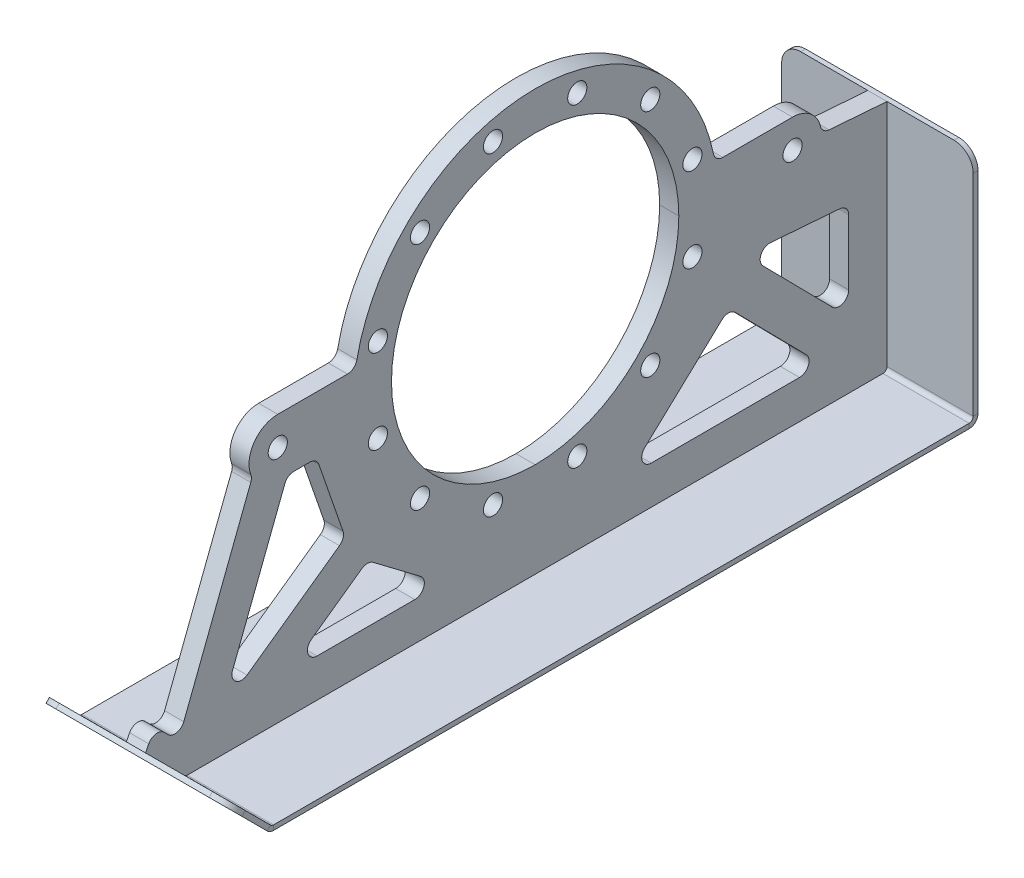
from build123d import *

# Parameters (mm, degrees)
FLANGE_PROFILE_DEPTH                = 12.7
F_7_8_1_DIAMETER_HOLE1_D            = 25.4
BOLT_PATTERN_COUNT                  = 12
SKETCH15_R                          = 12.7
BOSS_EXTRUDE1_DEPTH                 = 12.7
SKETCH5_W                           = 254
SKETCH5_H                           = 1317.865260112
BASE_SKID_DEPTH                     = 6.35
BEND_START                          = -127
BEND_HEEL_DEPTH                     = 254
BEND_HEEL_2_DEPTH                   = 254
BEND_TOE_DEPTH                      = 254
BEND_TOE_2_DEPTH                    = 254
WEBBING_BODY_DEPTH                  = 12.7
WEBBING_HOLES_DEPTH                 = 774.747599071
WEBBING_HOLES_DEPTH_BACK            = 774.747599071
WEBBING_FILLET_R                    = 12.7
SKID_START                          = -472.929130056
SKID_EDGES_DEPTH                    = 6.35
SKID_START_2                        = -334.061851681
SKID_EDGES_2_DEPTH                  = 6.35
FLANGE_FILLET_R                     = 12.7
FILLET1_R                           = 12.7
CONVERT_START                       = -12.7
CONVERT_FLANGE_TO_SHEET_OUTLINE_R   = 12.7
CONVERT_FLANGE_TO_SHEET_OUTLINE_R_2 = 190.5
CONVERT_FLANGE_TO_SHEET_DEPTH       = 25.4


# Read off the part's stored shape, not the designer's step: Bend Heel, Bend Toe, Skid Edges, Convert Flange to Sheet
# Sheet-metal steps are written as plain solids
with BuildPart() as part:
    # Sketch1 → Flange Profile (new, symmetric)
    with BuildSketch(Plane(origin=(0, 0, 0), x_dir=(0, 0, -1), z_dir=(1, 0, 0))):
        with BuildLine():
            ThreePointArc((-190.5, 316.3), (0, 506.8), (190.5, 316.3))
            Line((190.5, 316.3), (241.3, 316.3))
            ThreePointArc((241.3, 316.3), (0, 557.6), (-241.3, 316.3))
            Line((-241.3, 316.3), (-190.5, 316.3))
        make_face()
        with BuildLine():
            Line((241.3, 316.3), (190.5, 316.3))
            ThreePointArc((190.5, 316.3), (0, 125.8), (-190.5, 316.3))
            Line((-190.5, 316.3), (-241.3, 316.3))
            ThreePointArc((-241.3, 316.3), (0, 75), (241.3, 316.3))
        make_face()
    extrude(amount=FLANGE_PROFILE_DEPTH, both=True)

    # 7/8 (1) Diameter Hole1 (through all)
    with Locations(Plane(origin=(12.7, 260.420968162, -208.543385896), x_dir=(0, 0, 1), z_dir=(1, 0, 0))):
        with Locations((0, 0)):
            f_7_8_1_diameter_hole1 = Hole(F_7_8_1_DIAMETER_HOLE1_D / 2)

    # Bolt Pattern: 7/8 (1) Diameter Hole1 ×12 about axis
    bolt_pattern_axis = Axis((0, 316.3, 0), (1, 0, 0))
    for i in range(1, BOLT_PATTERN_COUNT):
        add(f_7_8_1_diameter_hole1.rotate(bolt_pattern_axis, i * 360 / BOLT_PATTERN_COUNT), mode=Mode.SUBTRACT)

    # Sketch15 → Boss-Extrude1 (add, symmetric)
    with BuildSketch(Plane(origin=(0, 0, 0), x_dir=(0, 0, -1), z_dir=(1, 0, 0))):
        with BuildLine():
            Line((-238.273120599, 278.2), (-341.3, 278.2))
            ThreePointArc((-341.3, 278.2), (-379.4, 316.3), (-341.3, 354.4))
            Line((-341.3, 354.4), (-238.273120599, 354.4))
            ThreePointArc((-238.273120599, 354.4), (-200.173120599, 316.3), (-238.273120599, 278.2))
        make_face()
        with Locations((-341.3, 316.3)):
            Circle(SKETCH15_R, mode=Mode.SUBTRACT)
    boss_extrude1 = extrude(amount=BOSS_EXTRUDE1_DEPTH, both=True)

    # Mirror2: Boss-Extrude1 across plane
    add(boss_extrude1.mirror(Plane.XY))

    # Sketch12 → Webbing Body (add, symmetric)
    with BuildSketch(Plane(origin=(0, 0, 0), x_dir=(0, 0, -1), z_dir=(1, 0, 0))):
        with BuildLine():
            Line((-516.69946035, 53.244915153), (-465.016837626, 1.562292429))
            ThreePointArc((-465.016837626, 1.562292429), (-463.286363484, 0.406026574), (-461.245130056, 0))
            Line((-461.245130056, 0), (461.245130056, 0))
            ThreePointArc((461.245130056, 0), (465.016837626, 1.562292429), (466.579130056, 5.334))
            Line((466.579130056, 5.334), (466.579130056, 309.66453199))
            Line((466.579130056, 309.66453199), (379.4, 316.3))
            ThreePointArc((379.4, 316.3), (368.240768363, 289.359231637), (341.3, 278.2))
            Line((341.3, 278.2), (238.273120599, 278.2))
            ThreePointArc((238.273120599, 278.2), (0, 75), (-238.273120599, 278.2))
            Line((-238.273120599, 278.2), (-341.3, 278.2))
            ThreePointArc((-341.3, 278.2), (-368.240768363, 289.359231637), (-379.4, 316.3))
            Line((-379.4, 316.3), (-516.69946035, 53.244915153))
        make_face()
    extrude(amount=WEBBING_BODY_DEPTH, both=True)

    # Sketch13 → Webbing Holes (cut, two sides: drawn at the far end of the back side and taken through both)
    with BuildSketch(Plane(origin=(0, 0, 0), x_dir=(0, 0, -1), z_dir=(1, 0, 0)).offset(-WEBBING_HOLES_DEPTH_BACK)):
        Polygon((-121.787355666, 50.8), (-328.927773528, 50.8), (-222.270083081, 126.778444056), align=None)
        Polygon((256.684840666, 176.88944598), (380.833369116, 50.8), (121.787355666, 50.8), align=None)
        Polygon((415.779130056, 216.93171249), (415.779130056, 87.713713005), (278.243059213, 227.4), align=None)
        Polygon((-416.484090731, 50.8), (-251.744141406, 168.15379766), (-289.7865603, 278.2), (-328.771856678, 278.2), align=None)
        with BuildLine():
            Line((-504.380536196, 76.847015483), (-379.4, 316.3))
            ThreePointArc((-379.4, 316.3), (-378.339738675, 307.374320256), (-375.217965412, 298.945414949))
            Line((-375.217965412, 298.945414949), (-472.992285501, 45.458764788))
            Line((-472.992285501, 45.458764788), (-504.380536196, 76.847015483))
        make_face()
    extrude(amount=WEBBING_HOLES_DEPTH + WEBBING_HOLES_DEPTH_BACK, mode=Mode.SUBTRACT)

    # Webbing Fillet
    webbing_fillet_edges = [part.edges().sort_by_distance(p)[0] for p in [
        (0, 50.8, 416.484090731),
        (0, 278.2, 328.771856678),
        (0, 278.2, 289.7865603),
        (0, 168.15379766, 251.744141406),
        (0, 176.88944598, -256.684840666),
        (0, 50.8, -380.833369116),
        (0, 50.8, -121.787355666),
        (0, 216.93171249, -415.779130056),
        (0, 87.713713005, -415.779130056),
        (0, 227.4, -278.243059213),
        (0, 50.8, 121.787355666),
        (0, 50.8, 328.927773528),
        (0, 126.778444056, 222.270083081),
    ]]
    fillet(webbing_fillet_edges, radius=WEBBING_FILLET_R)

    # Flange Fillet
    flange_fillet_edges = [part.edges().sort_by_distance(p)[0] for p in [
        (0, 298.945414949, 375.217965412),
        (0, 354.4, 238.273120599),
        (0, 354.4, -238.273120599),
        (0, 316.3, -379.4),
    ]]
    fillet(flange_fillet_edges, radius=FLANGE_FILLET_R)

    # Fillet1
    fillet1_edges = [part.edges().sort_by_distance(p)[0] for p in [
        (0, 76.847015483, 504.380536196),
        (0, 45.458764788, 472.992285501),
    ]]
    fillet(fillet1_edges, radius=FILLET1_R)


with BuildPart() as body_2:
    # Sketch5 → Base Skid (new body)
    with BuildSketch(Plane(origin=(0, 0, 0), x_dir=(1, 0, 0), z_dir=(0, 1, 0))):
        with Locations((0, 118.6125)):
            Rectangle(SKETCH5_W, SKETCH5_H)
    extrude(amount=-BASE_SKID_DEPTH)

    # Bend Heel outline → Bend Heel (cut)
    with BuildSketch(Plane.YZ.offset(BEND_START)):
        with BuildLine():
            Line((0, -777.545130056), (0, -471.640528076))
            ThreePointArc((0, -471.640528076), (-4.636915504, -467.33583609), (-6.35, -461.245130056))
            Line((-6.35, -461.245130056), (-6.35, -777.545130056))
            Line((-6.35, -777.545130056), (0, -777.545130056))
        make_face()
    extrude(amount=BEND_HEEL_DEPTH, mode=Mode.SUBTRACT)

    # Bend Heel 2 outline → Bend Heel 2 (add)
    with BuildSketch(Plane.YZ.offset(BEND_START)):
        with BuildLine():
            Line((5.334, -472.929130056), (309.66453199, -472.929130056))
            Line((309.66453199, -472.929130056), (309.66453199, -466.579130056))
            Line((309.66453199, -466.579130056), (5.334, -466.579130056))
            ThreePointArc((5.334, -466.579130056), (1.56229243, -465.016837626), (0, -461.245130056))
            Line((0, -461.245130056), (0, -471.640528076))
            ThreePointArc((0, -471.640528076), (2.590277571, -472.602411563), (5.334, -472.929130056))
        make_face()
    extrude(amount=BEND_HEEL_2_DEPTH)

    # Bend Toe outline → Bend Toe (cut)
    with BuildSketch(Plane.YZ.offset(BEND_START)):
        with BuildLine():
            Line((-6.35, 540.320130056), (-6.35, 461.245130056))
            ThreePointArc((-6.35, 461.245130056), (-5.460608458, 465.71640328), (-2.927835631, 469.506965687))
            Line((-2.927835631, 469.506965687), (0, 472.434801318))
            Line((0, 472.434801318), (0, 540.320130056))
            Line((0, 540.320130056), (-6.35, 540.320130056))
        make_face()
    extrude(amount=BEND_TOE_DEPTH, mode=Mode.SUBTRACT)

    # Bend Toe 2 outline → Bend Toe 2 (add)
    with BuildSketch(Plane.YZ.offset(BEND_START)):
        with BuildLine():
            Line((48.754787092, 521.189588411), (0, 472.434801318))
            Line((0, 472.434801318), (0, 461.245130056))
            ThreePointArc((0, 461.245130056), (0.406026574, 463.286363484), (1.562292429, 465.016837626))
            Line((1.562292429, 465.016837626), (53.244915153, 516.69946035))
            Line((53.244915153, 516.69946035), (48.754787092, 521.189588411))
        make_face()
    extrude(amount=BEND_TOE_2_DEPTH)

    # Skid Edges outline → Skid Edges (cut)
    with BuildSketch(Plane.XY.offset(SKID_START)):
        with BuildLine():
            ThreePointArc((-127, 284.26453199), (-119.560512242, 302.225044232), (-101.6, 309.66453199))
            Line((-101.6, 309.66453199), (-127, 309.66453199))
            Line((-127, 309.66453199), (-127, 284.26453199))
        make_face()
        with BuildLine():
            ThreePointArc((101.6, 309.66453199), (119.560512242, 302.225044232), (127, 284.26453199))
            Line((127, 284.26453199), (127, 309.66453199))
            Line((127, 309.66453199), (101.6, 309.66453199))
        make_face()
    extrude(amount=SKID_EDGES_DEPTH, mode=Mode.SUBTRACT)

    # Skid Edges 2 outline → Skid Edges 2 (cut)
    with BuildSketch(Plane(origin=(0, 0, 0), x_dir=(1, 0, 0), z_dir=(0, 0.707106781186546, -0.707106781186549)).offset(SKID_START_2)):
        with BuildLine():
            Line((-127, -403.011532817), (-101.6, -403.011532817))
            ThreePointArc((-101.6, -403.011532817), (-119.560512242, -395.572045059), (-127, -377.611532817))
            Line((-127, -377.611532817), (-127, -403.011532817))
        make_face()
        with BuildLine():
            ThreePointArc((127, -377.611532817), (119.560512242, -395.572045059), (101.6, -403.011532817))
            Line((101.6, -403.011532817), (127, -403.011532817))
            Line((127, -403.011532817), (127, -377.611532817))
        make_face()
    extrude(amount=SKID_EDGES_2_DEPTH, mode=Mode.SUBTRACT)


with BuildPart() as body_3:
    # Convert Flange to Sheet outline → Convert Flange to Sheet (new body)
    with BuildSketch(Plane.YZ.offset(CONVERT_START)):
        with BuildLine():
            ThreePointArc((64.613364326, 492.146885039), (68.186341854, 503.052322953), (61.509490514, 512.385832512))
            Line((61.509490514, 512.385832512), (53.244915153, 516.69946035))
            Line((53.244915153, 516.69946035), (1.562292429, 465.016837626))
            ThreePointArc((1.562292429, 465.016837626), (0.406026574, 463.286363484), (0, 461.245130056))
            Line((0, 461.245130056), (0, -461.245130056))
            ThreePointArc((0, -461.245130056), (1.56229243, -465.016837626), (5.334, -466.579130056))
            Line((5.334, -466.579130056), (309.66453199, -466.579130056))
            Line((309.66453199, -466.579130056), (315.51389229, -389.728161662))
            ThreePointArc((315.51389229, -389.728161662), (318.507984292, -382.458236277), (325.207948432, -378.344007002))
            ThreePointArc((325.207948432, -378.344007002), (346.224929701, -364.881954592), (354.4, -341.3))
            Line((354.4, -341.3), (354.4, -248.868157867))
            ThreePointArc((354.4, -248.868157867), (357.262622301, -240.83597261), (364.56, -236.424749973))
            ThreePointArc((364.56, -236.424749973), (557.6, 0), (364.56, 236.424749973))
            ThreePointArc((364.56, 236.424749973), (357.262622301, 240.83597261), (354.4, 248.868157867))
            Line((354.4, 248.868157867), (354.4, 341.3))
            ThreePointArc((354.4, 341.3), (338.066812973, 372.570047218), (303.071083831, 377.029620443))
            ThreePointArc((303.071083831, 377.029620443), (298.575508282, 376.239784681), (294.091033306, 377.090386955))
            Line((294.091033306, 377.090386955), (63.672579247, 465.966892551))
            ThreePointArc((63.672579247, 465.966892551), (55.818388763, 475.185551264), (59.262734928, 486.796255641))
            Line((59.262734928, 486.796255641), (64.613364326, 492.146885039))
        make_face()
        with BuildLine():
            ThreePointArc((168.439629954, -247.644758669), (171.858848828, -256.580460186), (168.071916446, -265.366640382))
            Line((168.071916446, -265.366640382), (72.410334659, -359.555686227))
            ThreePointArc((72.410334659, -359.555686227), (58.594454677, -362.220383043), (50.8, -350.506048871))
            Line((50.8, -350.506048871), (50.8, -153.972935338))
            ThreePointArc((50.8, -153.972935338), (58.838520177, -142.159358155), (72.778048167, -145.30069098))
            Line((72.778048167, -145.30069098), (168.439629954, -247.644758669))
        make_face(mode=Mode.SUBTRACT)
        with BuildLine():
            ThreePointArc((217.82498664, -404.042977729), (213.794375631, -412.393926496), (205.161614354, -415.779130056))
            Line((205.161614354, -415.779130056), (118.713715248, -415.779130056))
            ThreePointArc((118.713715248, -415.779130056), (106.961685755, -407.893670822), (109.803380589, -394.0294927))
            Line((109.803380589, -394.0294927), (203.254649706, -302.016735785))
            ThreePointArc((203.254649706, -302.016735785), (217.511833293, -299.546772169), (224.828356651, -312.030220814))
            Line((224.828356651, -312.030220814), (217.82498664, -404.042977729))
        make_face(mode=Mode.SUBTRACT)
        with Locations((107.756614104, -55.879031838)):
            Circle(CONVERT_FLANGE_TO_SHEET_OUTLINE_R, mode=Mode.SUBTRACT)
        with Locations((163.635645942, -152.664354058)):
            Circle(CONVERT_FLANGE_TO_SHEET_OUTLINE_R, mode=Mode.SUBTRACT)
        with Locations((260.420968162, -208.543385896)):
            Circle(CONVERT_FLANGE_TO_SHEET_OUTLINE_R, mode=Mode.SUBTRACT)
        with Locations((316.3, -341.3)):
            Circle(CONVERT_FLANGE_TO_SHEET_OUTLINE_R, mode=Mode.SUBTRACT)
        with Locations((372.179031838, -208.543385896)):
            Circle(CONVERT_FLANGE_TO_SHEET_OUTLINE_R, mode=Mode.SUBTRACT)
        with Locations((316.3, 0)):
            Circle(CONVERT_FLANGE_TO_SHEET_OUTLINE_R_2, mode=Mode.SUBTRACT)
        with Locations((468.964354058, -152.664354058)):
            Circle(CONVERT_FLANGE_TO_SHEET_OUTLINE_R, mode=Mode.SUBTRACT)
        with Locations((524.843385896, -55.879031838)):
            Circle(CONVERT_FLANGE_TO_SHEET_OUTLINE_R, mode=Mode.SUBTRACT)
        with Locations((107.756614104, 55.879031838)):
            Circle(CONVERT_FLANGE_TO_SHEET_OUTLINE_R, mode=Mode.SUBTRACT)
        with BuildLine():
            ThreePointArc((73.630094109, 151.980526264), (59.460333874, 147.599844206), (50.8, 159.640238618))
            Line((50.8, 159.640238618), (50.8, 289.210576193))
            ThreePointArc((50.8, 289.210576193), (59.631973868, 301.307202741), (73.843838401, 296.579090775))
            Line((73.843838401, 296.579090775), (121.36982462, 229.862642585))
            ThreePointArc((121.36982462, 229.862642585), (123.724701875, 222.313516013), (121.156080328, 214.83441565))
            Line((121.156080328, 214.83441565), (73.630094109, 151.980526264))
        make_face(mode=Mode.SUBTRACT)
        with Locations((163.635645942, 152.664354058)):
            Circle(CONVERT_FLANGE_TO_SHEET_OUTLINE_R, mode=Mode.SUBTRACT)
        with Locations((260.420968162, 208.543385896)):
            Circle(CONVERT_FLANGE_TO_SHEET_OUTLINE_R, mode=Mode.SUBTRACT)
        with BuildLine():
            ThreePointArc((75.327084944, 382.053243061), (75.637860095, 397.208133038), (90.241335147, 401.270864611))
            Line((90.241335147, 401.270864611), (270.070411802, 331.907583779))
            ThreePointArc((270.070411802, 331.907583779), (275.972206785, 327.243383564), (278.2, 320.05847681))
            Line((278.2, 320.05847681), (278.2, 298.833680473))
            ThreePointArc((278.2, 298.833680473), (275.843770908, 291.465071146), (269.64938529, 286.830655782))
            Line((269.64938529, 286.830655782), (177.134112511, 254.848591102))
            ThreePointArc((177.134112511, 254.848591102), (169.116590289, 254.755024674), (162.64088882, 259.48310121))
            Line((162.64088882, 259.48310121), (75.327084944, 382.053243061))
        make_face(mode=Mode.SUBTRACT)
        with Locations((372.179031838, 208.543385896)):
            Circle(CONVERT_FLANGE_TO_SHEET_OUTLINE_R, mode=Mode.SUBTRACT)
        with Locations((524.843385896, 55.879031838)):
            Circle(CONVERT_FLANGE_TO_SHEET_OUTLINE_R, mode=Mode.SUBTRACT)
        with Locations((468.964354058, 152.664354058)):
            Circle(CONVERT_FLANGE_TO_SHEET_OUTLINE_R, mode=Mode.SUBTRACT)
        with Locations((316.3, 341.3)):
            Circle(CONVERT_FLANGE_TO_SHEET_OUTLINE_R, mode=Mode.SUBTRACT)
    extrude(amount=CONVERT_FLANGE_TO_SHEET_DEPTH)


solid = Compound([body_2.part, body_3.part])
